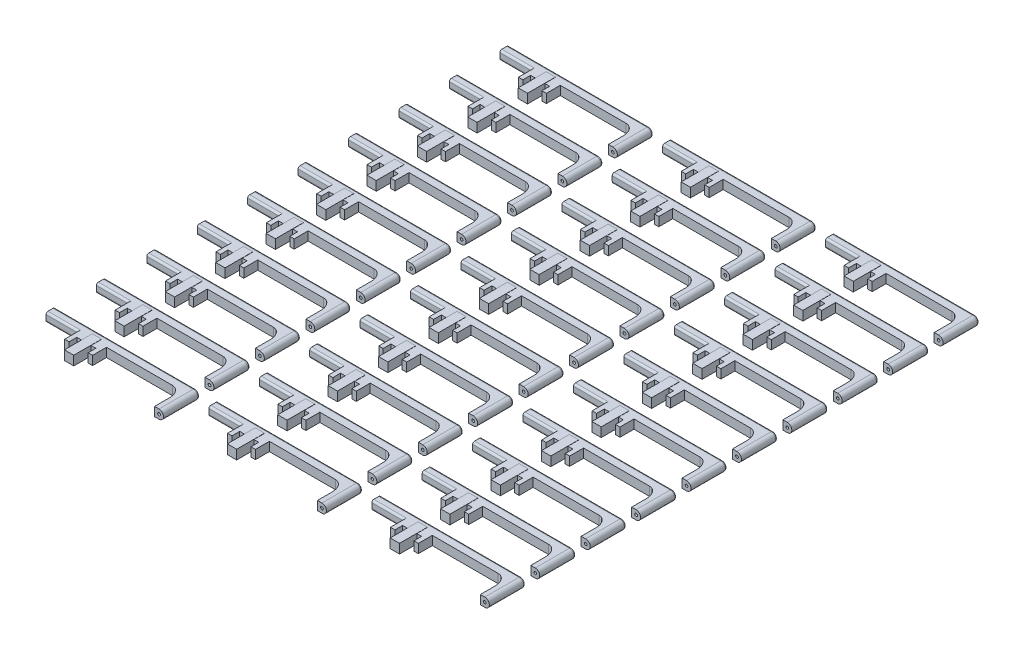
from build123d import *

# Parameters (mm, degrees)
SKETCH_1_W               = 2.4
SKETCH_1_H               = 2.4
EXTRUDE_1_DEPTH          = 7.2
EXTRUDE_2_DEPTH          = 23
EXTRUDE_2_DEPTH_BACK     = 12
SKETCH_4_W               = 2.3
SKETCH_4_H               = 2.3
EXTRUDE_3_DEPTH          = 7
EXTRUDE_3_DEPTH_BACK     = 2.3
SKETCH_5_R               = 0.35
SKETCH_6_R               = 0.35
CUT_EXTRUDE_1_DEPTH      = 10
FILLET_1_SIZE            = 2.4
FILLET_1_SIZE_2          = 3.2
FILLET_2_R               = 0.5
EXTRUDE_START            = -1.5
SKETCH_7_W               = 1.15
SKETCH_7_H               = 0.5
SKETCH_7_H_2             = 1.3
SKETCH_7_H_3             = 2.3
EXTRUDE_4_DEPTH          = 5.1
SKETCH_8_W               = 7.2
SKETCH_8_H               = 2.3
EXTRUDE_5_DEPTH          = 3.1
PATTERN_LINEAR_1_COUNT   = 10
PATTERN_LINEAR_1_PITCH   = 13
PATTERN_LINEAR_1_2_COUNT = 3
PATTERN_LINEAR_1_2_PITCH = 42


with BuildPart() as part:
    # 草图1 → 凸台-拉伸1 (new body)
    with BuildSketch(Plane.XY):
        Rectangle(SKETCH_1_W, SKETCH_1_H)
    extrude(amount=EXTRUDE_1_DEPTH)

    # 草图4 → 凸台-拉伸2 (add, two sides: drawn at the far end of the back side and taken through both)
    with BuildSketch(Plane(origin=(0, 0, 0), x_dir=(0, 0, -1), z_dir=(1, 0, 0)).offset(-EXTRUDE_2_DEPTH_BACK)):
        Rectangle(SKETCH_4_W, SKETCH_4_H)
    extrude(amount=EXTRUDE_2_DEPTH + EXTRUDE_2_DEPTH_BACK)

    # 草图5 → 凸台-拉伸3 (add, two sides: drawn at the far end of the back side and taken through both)
    with BuildSketch(Plane.XY.offset(1.15).offset(-EXTRUDE_3_DEPTH_BACK)):
        with BuildLine():
            Line((23, 0), (23, 1.15))
            Line((23, 1.15), (24.15, 1.15))
            ThreePointArc((24.15, 1.15), (25.3, 0), (24.15, -1.15))
            Line((24.15, -1.15), (23, -1.15))
            Line((23, -1.15), (23, 0))
        make_face()
        with Locations(Location((24.15, 0, 0), (0, 0, 180))):
            Circle(SKETCH_5_R, mode=Mode.SUBTRACT)
    extrude(amount=EXTRUDE_3_DEPTH + EXTRUDE_3_DEPTH_BACK)

    # 草图6 → 切除-拉伸1 (cut)
    with BuildSketch(Plane.ZY.offset(12)):
        Circle(SKETCH_6_R)
    extrude(amount=-CUT_EXTRUDE_1_DEPTH, mode=Mode.SUBTRACT)

    # 圆角1
    # an asymmetric fillet: 3.2, 2.4 mm, written as the material it adds along each edge
    with BuildSketch(Plane(origin=(23, 1.15, 1.15), x_dir=(-1, 0, 0), z_dir=(0, -1, 0))) as fillet_1_piece_1:
        with BuildLine():
            Bezier((FILLET_1_SIZE, 0), (0, 0), (0, -FILLET_1_SIZE_2), weights=[1, 0.707106781, 1])
            Line((0, -FILLET_1_SIZE_2), (0, 0))
            Line((0, 0), (FILLET_1_SIZE, 0))
        make_face()
    extrude(amount=2.3)

    # 圆角2
    fillet_2_edges = [part.edges().sort_by_distance(p)[0] for p in [
        (-6.6, -1.15, 1.15),
        (6.075, -1.15, -1.15),
        (-6.6, 1.15, 1.15),
        (6.075, 1.15, -1.15),
        (25.3, 0, -1.15),
    ]]
    fillet(fillet_2_edges, radius=FILLET_2_R)

    # 草图7 → 凸台-拉伸4 (add)
    with BuildSketch(Plane.XY.offset(1.15).offset(EXTRUDE_START)):
        with Locations((-3.025, 0.9)):
            Rectangle(SKETCH_7_W, SKETCH_7_H)
        with Locations((-3.025, 0)):
            Rectangle(SKETCH_7_W, SKETCH_7_H_2)
        with Locations((-3.025, -0.9)):
            Rectangle(SKETCH_7_W, SKETCH_7_H)
        with Locations((3.025, 0)):
            Rectangle(SKETCH_7_W, SKETCH_7_H_3)
    extrude(amount=EXTRUDE_4_DEPTH)

    # 草图8 → 凸台-拉伸5 (add)
    with BuildSketch(Plane.XY.offset(1.15).offset(EXTRUDE_START)):
        Rectangle(SKETCH_8_W, SKETCH_8_H)
    extrude(amount=EXTRUDE_5_DEPTH)


with BuildPart() as pattern_linear_1_1:
    # 阵列(线性)1: pattern copy
    add(part.part.moved(Location(Vector(0, 0, -1) * (1 * PATTERN_LINEAR_1_PITCH))))


with BuildPart() as pattern_linear_1_2:
    # 阵列(线性)1: pattern copy
    add(part.part.moved(Location(Vector(0, 0, -1) * (2 * PATTERN_LINEAR_1_PITCH))))


with BuildPart() as pattern_linear_1_3:
    # 阵列(线性)1: pattern copy
    add(part.part.moved(Location(Vector(0, 0, -1) * (3 * PATTERN_LINEAR_1_PITCH))))


with BuildPart() as pattern_linear_1_4:
    # 阵列(线性)1: pattern copy
    add(part.part.moved(Location(Vector(0, 0, -1) * (4 * PATTERN_LINEAR_1_PITCH))))


with BuildPart() as pattern_linear_1_5:
    # 阵列(线性)1: pattern copy
    add(part.part.moved(Location(Vector(0, 0, -1) * (5 * PATTERN_LINEAR_1_PITCH))))


with BuildPart() as pattern_linear_1_6:
    # 阵列(线性)1: pattern copy
    add(part.part.moved(Location(Vector(0, 0, -1) * (6 * PATTERN_LINEAR_1_PITCH))))


with BuildPart() as pattern_linear_1_7:
    # 阵列(线性)1: pattern copy
    add(part.part.moved(Location(Vector(0, 0, -1) * (7 * PATTERN_LINEAR_1_PITCH))))


with BuildPart() as pattern_linear_1_8:
    # 阵列(线性)1: pattern copy
    add(part.part.moved(Location(Vector(0, 0, -1) * (8 * PATTERN_LINEAR_1_PITCH))))


with BuildPart() as pattern_linear_1_9:
    # 阵列(线性)1: pattern copy
    add(part.part.moved(Location(Vector(0, 0, -1) * (9 * PATTERN_LINEAR_1_PITCH))))


with BuildPart() as pattern_linear_1_2_1:
    # Pattern Linear 1 2: pattern copy
    add(part.part.moved(Location(Vector(1, 0, 0) * (1 * PATTERN_LINEAR_1_2_PITCH))))


with BuildPart() as pattern_linear_1_2_2:
    # Pattern Linear 1 2: pattern copy
    add(part.part.moved(Location(Vector(1, 0, 0) * (2 * PATTERN_LINEAR_1_2_PITCH))))


with BuildPart() as pattern_linear_1_2_3:
    # Pattern Linear 1 2: pattern copy
    add(pattern_linear_1_1.part.moved(Location(Vector(1, 0, 0) * (1 * PATTERN_LINEAR_1_2_PITCH))))


with BuildPart() as pattern_linear_1_2_4:
    # Pattern Linear 1 2: pattern copy
    add(pattern_linear_1_1.part.moved(Location(Vector(1, 0, 0) * (2 * PATTERN_LINEAR_1_2_PITCH))))


with BuildPart() as pattern_linear_1_2_5:
    # Pattern Linear 1 2: pattern copy
    add(pattern_linear_1_2.part.moved(Location(Vector(1, 0, 0) * (1 * PATTERN_LINEAR_1_2_PITCH))))


with BuildPart() as pattern_linear_1_2_6:
    # Pattern Linear 1 2: pattern copy
    add(pattern_linear_1_2.part.moved(Location(Vector(1, 0, 0) * (2 * PATTERN_LINEAR_1_2_PITCH))))


with BuildPart() as pattern_linear_1_2_7:
    # Pattern Linear 1 2: pattern copy
    add(pattern_linear_1_3.part.moved(Location(Vector(1, 0, 0) * (1 * PATTERN_LINEAR_1_2_PITCH))))


with BuildPart() as pattern_linear_1_2_8:
    # Pattern Linear 1 2: pattern copy
    add(pattern_linear_1_3.part.moved(Location(Vector(1, 0, 0) * (2 * PATTERN_LINEAR_1_2_PITCH))))


with BuildPart() as pattern_linear_1_2_9:
    # Pattern Linear 1 2: pattern copy
    add(pattern_linear_1_4.part.moved(Location(Vector(1, 0, 0) * (1 * PATTERN_LINEAR_1_2_PITCH))))


with BuildPart() as pattern_linear_1_2_10:
    # Pattern Linear 1 2: pattern copy
    add(pattern_linear_1_4.part.moved(Location(Vector(1, 0, 0) * (2 * PATTERN_LINEAR_1_2_PITCH))))


with BuildPart() as pattern_linear_1_2_11:
    # Pattern Linear 1 2: pattern copy
    add(pattern_linear_1_5.part.moved(Location(Vector(1, 0, 0) * (1 * PATTERN_LINEAR_1_2_PITCH))))


with BuildPart() as pattern_linear_1_2_12:
    # Pattern Linear 1 2: pattern copy
    add(pattern_linear_1_5.part.moved(Location(Vector(1, 0, 0) * (2 * PATTERN_LINEAR_1_2_PITCH))))


with BuildPart() as pattern_linear_1_2_13:
    # Pattern Linear 1 2: pattern copy
    add(pattern_linear_1_6.part.moved(Location(Vector(1, 0, 0) * (1 * PATTERN_LINEAR_1_2_PITCH))))


with BuildPart() as pattern_linear_1_2_14:
    # Pattern Linear 1 2: pattern copy
    add(pattern_linear_1_6.part.moved(Location(Vector(1, 0, 0) * (2 * PATTERN_LINEAR_1_2_PITCH))))


with BuildPart() as pattern_linear_1_2_15:
    # Pattern Linear 1 2: pattern copy
    add(pattern_linear_1_7.part.moved(Location(Vector(1, 0, 0) * (1 * PATTERN_LINEAR_1_2_PITCH))))


with BuildPart() as pattern_linear_1_2_16:
    # Pattern Linear 1 2: pattern copy
    add(pattern_linear_1_7.part.moved(Location(Vector(1, 0, 0) * (2 * PATTERN_LINEAR_1_2_PITCH))))


with BuildPart() as pattern_linear_1_2_17:
    # Pattern Linear 1 2: pattern copy
    add(pattern_linear_1_8.part.moved(Location(Vector(1, 0, 0) * (1 * PATTERN_LINEAR_1_2_PITCH))))


with BuildPart() as pattern_linear_1_2_18:
    # Pattern Linear 1 2: pattern copy
    add(pattern_linear_1_8.part.moved(Location(Vector(1, 0, 0) * (2 * PATTERN_LINEAR_1_2_PITCH))))


with BuildPart() as pattern_linear_1_2_19:
    # Pattern Linear 1 2: pattern copy
    add(pattern_linear_1_9.part.moved(Location(Vector(1, 0, 0) * (1 * PATTERN_LINEAR_1_2_PITCH))))


with BuildPart() as pattern_linear_1_2_20:
    # Pattern Linear 1 2: pattern copy
    add(pattern_linear_1_9.part.moved(Location(Vector(1, 0, 0) * (2 * PATTERN_LINEAR_1_2_PITCH))))


solid = Compound([part.part, pattern_linear_1_1.part, pattern_linear_1_2.part, pattern_linear_1_3.part, pattern_linear_1_4.part, pattern_linear_1_5.part, pattern_linear_1_6.part, pattern_linear_1_7.part, pattern_linear_1_8.part, pattern_linear_1_9.part, pattern_linear_1_2_1.part, pattern_linear_1_2_2.part, pattern_linear_1_2_3.part, pattern_linear_1_2_4.part, pattern_linear_1_2_5.part, pattern_linear_1_2_6.part, pattern_linear_1_2_7.part, pattern_linear_1_2_8.part, pattern_linear_1_2_9.part, pattern_linear_1_2_10.part, pattern_linear_1_2_11.part, pattern_linear_1_2_12.part, pattern_linear_1_2_13.part, pattern_linear_1_2_14.part, pattern_linear_1_2_15.part, pattern_linear_1_2_16.part, pattern_linear_1_2_17.part, pattern_linear_1_2_18.part, pattern_linear_1_2_19.part, pattern_linear_1_2_20.part])
